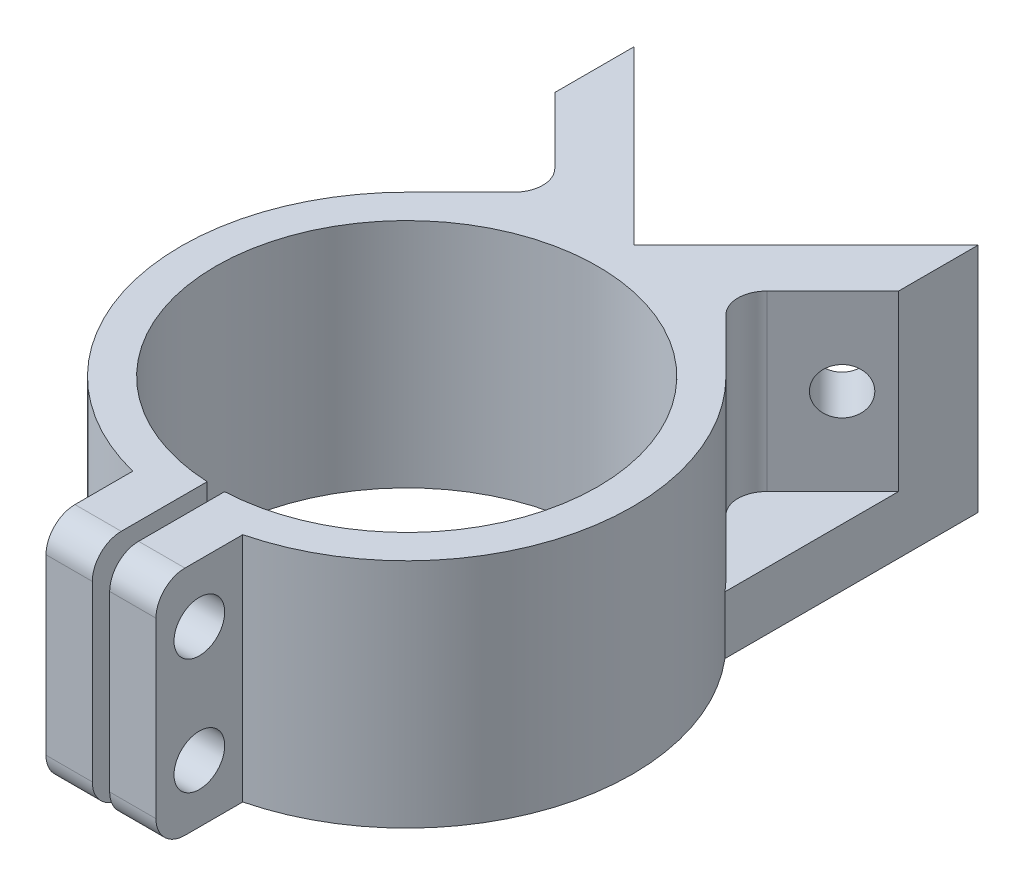
from build123d import *
from build123d.topology import SkipClean

# Parameters (mm, degrees)
BOSS_EXTRUDE7_DEPTH = 40
BOSS_EXTRUDE8_DEPTH = 10
SKETCH16_R          = 4
CUT_EXTRUDE6_DEPTH  = 93.663838512
SKETCH17_R          = 4.375
CUT_EXTRUDE7_DEPTH  = 10
FILLET2_R           = 5


with BuildPart() as part:
    # Sketch15 → Boss-Extrude7 (new body)
    with BuildSketch(Plane(origin=(0, 0, 0), x_dir=(0, 0, -1), z_dir=(0, 1, 0))):
        with BuildLine():
            ThreePointArc((33, 0), (0.750193874, -32.991471764), (-32.965891464, -1.5))
            Line((-32.965891464, -1.5), (-52.815891464, -1.5))
            Line((-52.815891464, -1.5), (-52.815891464, -9.5))
            Line((-52.815891464, -9.5), (-37.825256113, -9.5))
            ThreePointArc((-37.825256113, -9.5), (-11.890195924, -37.143279889), (25.276669084, -29.7))
            ThreePointArc((25.276669084, -29.7), (26.44822372, -28.661672353), (27.577164466, -27.577164466))
            Line((27.577164466, -27.577164466), (40.368228689, -14.786100244))
            Line((40.368228689, -14.786100244), (55.282128445, -29.7))
            Line((55.282128445, -29.7), (69, -29.7))
            Line((69, -29.7), (39.3, 0))
            Line((39.3, 0), (33, 0))
        make_face()
    extrude(amount=BOSS_EXTRUDE7_DEPTH)

    # Sketch15<4> → Boss-Extrude8 (add)
    with BuildSketch(Plane(origin=(0, 0, 0), x_dir=(0, 0, -1), z_dir=(0, 1, 0))):
        with BuildLine():
            ThreePointArc((27.577164466, -27.577164466), (26.44822372, -28.661672353), (25.276669084, -29.7))
            Line((25.276669084, -29.7), (55.282128445, -29.7))
            Line((55.282128445, -29.7), (40.368228689, -14.786100244))
            Line((40.368228689, -14.786100244), (27.577164466, -27.577164466))
        make_face()
    extrude(amount=BOSS_EXTRUDE8_DEPTH)

    # Sketch16 → Cut-Extrude6 (cut, through all)
    with BuildSketch(Plane(origin=(-12.791064222, 0, -12.791064222), x_dir=(-0.707106781186546, 0, 0.707106781186549), z_dir=(0.707106781186549, 0, 0.707106781186546))):
        with Locations((-53.189296501, -25)):
            Circle(SKETCH16_R)
    extrude(amount=-CUT_EXTRUDE6_DEPTH, mode=Mode.SUBTRACT)

    # Sketch17 → Cut-Extrude7 (cut)
    with BuildSketch(Plane(origin=(0, 0, 0), x_dir=(0, -1, 0), z_dir=(1, 0, 0))):
        with Locations((-30, -45.320573788)):
            Circle(SKETCH17_R)
        with Locations((-10, -45.320573788)):
            Circle(SKETCH17_R)
    extrude(amount=CUT_EXTRUDE7_DEPTH, mode=Mode.SUBTRACT)

    # Fillet2
    fillet2_edges = [part.edges().sort_by_distance(p)[0] for p in [
        (14.786100244, 25, -40.368228689),
        (5.5, 0, 52.815891464),
        (5.5, 40, 52.815891464),
    ]]
    fillet(fillet2_edges, radius=FILLET2_R)

    # Mirror2: part across plane


with BuildPart() as part_1:
    with SkipClean():  # the faces are left unmerged after this step: merging them gives an invalid solid
        add(part.part)
        add(part.part.mirror(Plane(origin=(0, 40, 0), x_dir=(0, 0, 1), z_dir=(-1, 0, 0))))


solid = part_1.part
